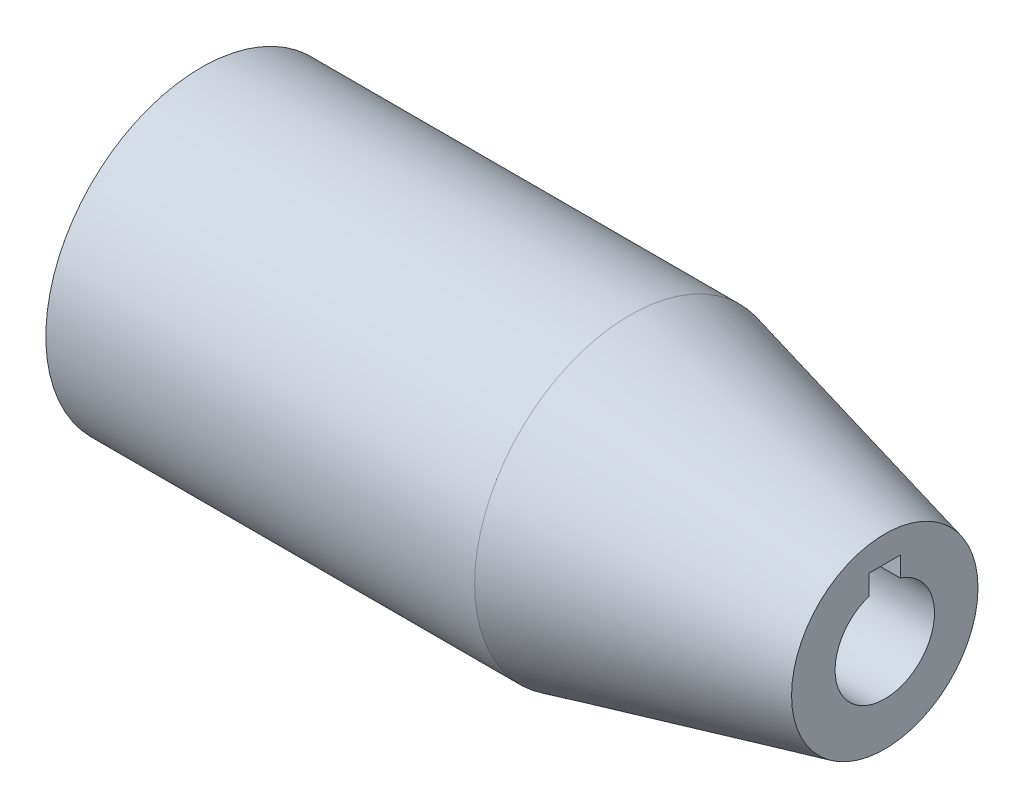
from build123d import *

# Parameters (mm, degrees)
SKETCH_2_R      = 15
EXTRUDE_2_DEPTH = 41
SKETCH_5_R      = 25
EXTRUDE_4_DEPTH = 9
EXTRUDE_START   = -9
SKETCH_6_R      = 25
EXTRUDE_5_DEPTH = 60


with BuildPart() as part:
    # Эскиз2 → Бобышка-Вытянуть2 (new body)
    with BuildSketch(Plane(origin=(0, 0, 0), x_dir=(0, 0, -1), z_dir=(1, 0, 0))):
        Circle(SKETCH_2_R)
        with BuildLine():
            Line((2.5, 10.8), (2.5, 7.599342077))
            ThreePointArc((2.5, 7.599342077), (6.480740698, 4.69041576), (8, 0))
            ThreePointArc((8, 0), (-4.69041576, -6.480740698), (-2.5, 7.599342077))
            Line((-2.5, 7.599342077), (-2.5, 10.8))
            Line((-2.5, 10.8), (0, 10.8))
            Line((0, 10.8), (2.5, 10.8))
        make_face(mode=Mode.SUBTRACT)
    extrude(amount=EXTRUDE_2_DEPTH)

    # Эскиз5 → Бобышка-Вытянуть4 (add)
    with BuildSketch(Plane(origin=(0, 0, 0), x_dir=(0, 0, -1), z_dir=(1, 0, 0))):
        Circle(SKETCH_5_R)
    extrude(amount=-EXTRUDE_4_DEPTH)

    # Эскиз6 → Бобышка-Вытянуть5 (add)
    with BuildSketch(Plane(origin=(0, 0, 0), x_dir=(0, 0, -1), z_dir=(1, 0, 0)).offset(EXTRUDE_START)):
        Circle(SKETCH_6_R)
        with BuildLine():
            ThreePointArc((14, 0), (-8.366600265, -11.22497216), (-4, 13.416407865))
            Line((-4, 13.416407865), (-4, 17.3))
            Line((-4, 17.3), (0, 17.3))
            Line((0, 17.3), (4, 17.3))
            Line((4, 17.3), (4, 13.416407865))
            ThreePointArc((4, 13.416407865), (11.22497216, 8.366600265), (14, 0))
        make_face(mode=Mode.SUBTRACT)
    extrude(amount=-EXTRUDE_5_DEPTH)

    # Эскиз7 → Повернуть1 (revolve)
    with BuildSketch(Plane(origin=(0, 0, 0), x_dir=(1, 0, 0), z_dir=(0, 1, 0))):
        Polygon((41, 15), (0, 25), (0, 15), align=None)
    revolve(axis=Axis((-60.197075593, 0, 0), (1, 0, 0)))


solid = part.part
